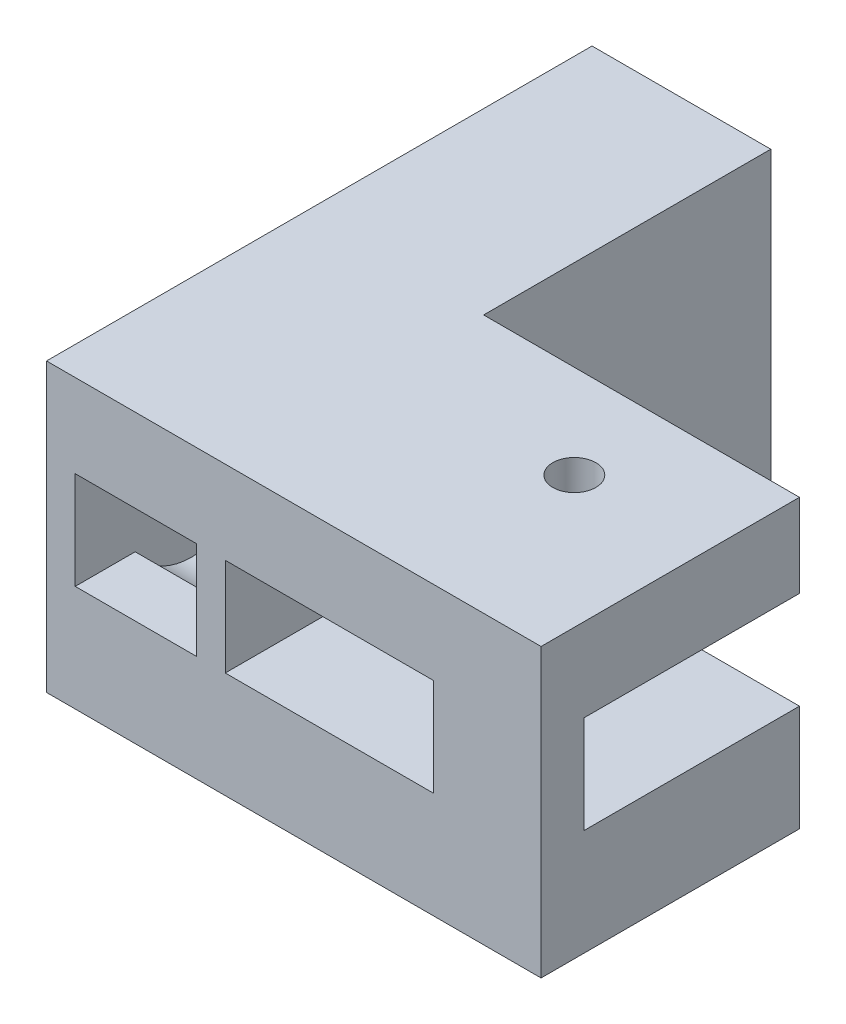
from build123d import *

# Parameters (mm, degrees)
SKETCH1_W             = 19
SKETCH1_H             = 7.4
BOSS_EXTRUDE1_DEPTH   = 18
SKETCH1_H_2           = 5.8
BOSS_EXTRUDE1_2_DEPTH = 18
SKETCH1_6_W           = 12.45
SKETCH1_6_H           = 5.8
BOSS_EXTRUDE6_DEPTH   = 38
BOSS_EXTRUDE7_DEPTH   = 10
SKETCH4_W             = 18
SKETCH4_H             = 7.4
SKETCH4_H_2           = 5.8
BOSS_EXTRUDE8_DEPTH   = 3
CUT_EXTRUDE1_START    = -7.4
SKETCH6_R             = 1.5
CUT_EXTRUDE1_DEPTH    = 20
BOSS_EXTRUDE10_REACH  = 46.586
SKETCH7_W             = 2
SKETCH7_H             = 38
BOSS_EXTRUDE11_REACH  = 47.064
SKETCH8_W             = 7.5
SKETCH8_H             = 3
SKETCH9_R             = 2
CUT_EXTRUDE2_DEPTH    = 2
CUT_EXTRUDE3_START    = -10.45
CUT_EXTRUDE3_DEPTH    = 8.45


# Read off the part's stored shape, not the designer's step: Cut-Extrude3
with BuildPart() as part:
    # Sketch1 → Boss-Extrude1 (new body)
    with BuildSketch(Plane.XY):
        with Locations((7.125, 0)):
            Rectangle(SKETCH1_W, SKETCH1_H)
    extrude(amount=-BOSS_EXTRUDE1_DEPTH)



with BuildPart() as body_2:
    # Sketch1 → Boss-Extrude1 2 (new body)
    with BuildSketch(Plane.XY):
        with Locations((7.125, 13.4)):
            Rectangle(SKETCH1_W, SKETCH1_H_2)
    extrude(amount=-BOSS_EXTRUDE1_2_DEPTH)


with BuildPart() as part_1:
    add(part.part)

    add(body_2.part)  # Boss-Extrude6 merges body 2
    # Sketch1<6> → Boss-Extrude6 (add)
    with BuildSketch(Plane.XY):
        Polygon((-14.825, 3.7), (-14.825, -0.7), (-9.825, -0.7), (-9.825, -3.7), (-2.375, -3.7), (-2.375, 3.7), align=None)
        with Locations((-8.6, 13.4)):
            Rectangle(SKETCH1_6_W, SKETCH1_6_H)
    extrude(amount=-BOSS_EXTRUDE6_DEPTH)

    # Sketch1<7> → Boss-Extrude7 (add)
    with BuildSketch(Plane.XY):
        Polygon((-14.825, -0.7), (-14.825, -2), (-14.825, -3.7), (-9.825, -3.7), (-9.825, -0.7), align=None)
    extrude(amount=-BOSS_EXTRUDE7_DEPTH)

    # Sketch4 → Boss-Extrude8 (add)
    with BuildSketch(Plane(origin=(16.625, 0, 0), x_dir=(0, 0, -1), z_dir=(1, 0, 0))):
        with Locations((9, 0)):
            Rectangle(SKETCH4_W, SKETCH4_H)
        with Locations((9, 13.4)):
            Rectangle(SKETCH4_W, SKETCH4_H_2)
    extrude(amount=BOSS_EXTRUDE8_DEPTH)

    # Sketch6 → Cut-Extrude1 (cut)
    with BuildSketch(Plane(origin=(0, 3.7, 0), x_dir=(1, 0, 0), z_dir=(0, 1, 0)).offset(CUT_EXTRUDE1_START)):
        with Locations(Location((10.44201924, 11.5, 0), (0, 0, 270))):
            Circle(SKETCH6_R)
    extrude(amount=CUT_EXTRUDE1_DEPTH, mode=Mode.SUBTRACT)

    # Sketch7 → Boss-Extrude10 (add, up to next)
    with BuildSketch(Plane(origin=(0, 3.7, 0), x_dir=(1, 0, 0), z_dir=(0, 1, 0)), mode=Mode.PRIVATE) as boss_extrude10_sk1:
        with Locations((-3.375, 19)):
            Rectangle(SKETCH7_W, SKETCH7_H)
    boss_extrude10_tool1 = extrude(boss_extrude10_sk1.sketch, amount=BOSS_EXTRUDE10_REACH, mode=Mode.PRIVATE) - part_1.part
    # Sketch7 → Boss-Extrude10 (add, up to next)
    with BuildSketch(Plane(origin=(0, 3.7, 0), x_dir=(1, 0, 0), z_dir=(0, 1, 0)), mode=Mode.PRIVATE) as boss_extrude10_sk2:
        with Locations((-13.825, 19)):
            Rectangle(SKETCH7_W, SKETCH7_H)
    boss_extrude10_tool2 = extrude(boss_extrude10_sk2.sketch, amount=BOSS_EXTRUDE10_REACH, mode=Mode.PRIVATE) - part_1.part
    add(boss_extrude10_tool1.solids().sort_by_distance((-3.375, 3.7, -19))[0])
    add(boss_extrude10_tool2.solids().sort_by_distance((-13.825, 3.7, -19))[0])

    # Sketch8 → Boss-Extrude11 (add, up to next)
    with BuildSketch(Plane.XZ.offset(-10.5), mode=Mode.PRIVATE) as boss_extrude11_sk1:
        with Locations((15.875, -1.5)):
            Rectangle(SKETCH8_W, SKETCH8_H)
    boss_extrude11_tool1 = extrude(boss_extrude11_sk1.sketch, amount=BOSS_EXTRUDE11_REACH, mode=Mode.PRIVATE) - part_1.part
    add(boss_extrude11_tool1.solids().sort_by_distance((15.875, 10.5, -1.5))[0])

    # Sketch9 → Cut-Extrude2 (cut)
    with BuildSketch(Plane.ZY.offset(14.825)):
        with Locations(Location((-8.095100141, 5.909535031, 0), (0, 0, 270))):
            Circle(SKETCH9_R)
    extrude(amount=-CUT_EXTRUDE2_DEPTH, mode=Mode.SUBTRACT)

    # Cut-Extrude3 outline → Cut-Extrude3 (cut)
    with BuildSketch(Plane.ZY.offset(14.825).offset(CUT_EXTRUDE3_START)):
        with BuildLine():
            Line((-4.174901811, 3.7), (-13.196516677, 3.7))
            Line((-13.196516677, 3.7), (-9.744129164, 1.722566762))
            ThreePointArc((-9.744129164, 1.722566762), (-6.589406594, 1.668911616), (-4.174901811, 3.7))
        make_face()
    extrude(amount=CUT_EXTRUDE3_DEPTH, mode=Mode.SUBTRACT)


solid = part_1.part
